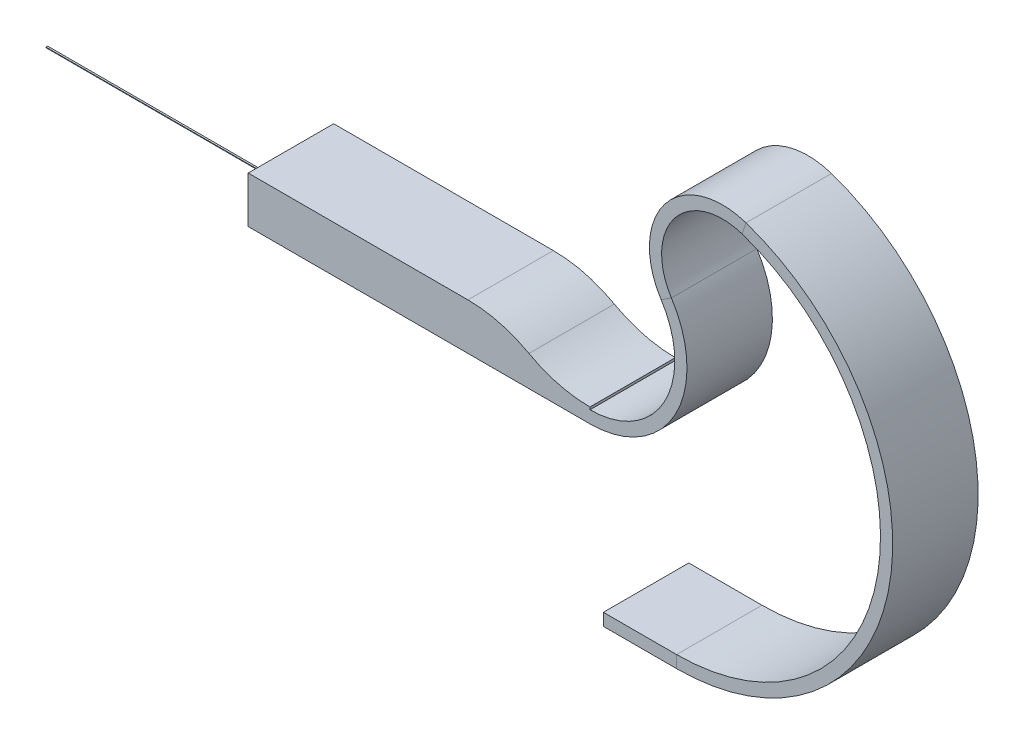
from build123d import *

# Parameters (mm, degrees)
SKETCH1_W               = 14
SKETCH1_H               = 3.5
BOSS_EXTRUDE1_DEPTH     = 1.9
CUT_EXTRUDE1_DEPTH      = 8.461400673
CUT_EXTRUDE1_DEPTH_BACK = 8.461400673
SKETCH4_W               = 0.07
SKETCH4_H               = 0.024
BOSS_EXTRUDE3_DEPTH     = 10
SWEEP1_START            = -1.75
SWEEP1_DEPTH            = 3.5


# Read off the part's stored shape, not the designer's step: Sweep1
with BuildPart() as part:
    # Sketch1 → Boss-Extrude1 (new body)
    with BuildSketch(Plane(origin=(0, 0, 0), x_dir=(1, 0, 0), z_dir=(0, 1, 0))):
        Rectangle(SKETCH1_W, SKETCH1_H)
    extrude(amount=BOSS_EXTRUDE1_DEPTH)

    # Sketch3 → Cut-Extrude1 (cut, two sides: drawn at the far end of the back side and taken through both)
    with BuildSketch(Plane.XY.offset(-CUT_EXTRUDE1_DEPTH_BACK)):
        with BuildLine():
            Line((7, 0.6), (7, 1.9))
            Line((7, 1.9), (2, 1.9))
            ThreePointArc((2, 1.9), (3.291559135, 1.734842828), (4.5, 1.25))
            ThreePointArc((4.5, 1.25), (5.708440865, 0.765157172), (7, 0.6))
        make_face()
    extrude(amount=CUT_EXTRUDE1_DEPTH + CUT_EXTRUDE1_DEPTH_BACK, mode=Mode.SUBTRACT)

    # Sketch4 → Boss-Extrude3 (add)
    with BuildSketch(Plane.ZY.offset(7)):
        with Locations((0, 0.5)):
            Rectangle(SKETCH4_W, SKETCH4_H)
    extrude(amount=BOSS_EXTRUDE3_DEPTH)

    # Sweep1 outline → Sweep1 (add)
    with BuildSketch(Plane.XY.offset(SWEEP1_START)):
        with BuildLine():
            Line((10.549140882, -6.409601789), (7.549140882, -6.409601789))
            Line((7.549140882, -6.409601789), (7.549140882, -6.909601789))
            Line((7.549140882, -6.909601789), (10.549140882, -6.909601789))
            ThreePointArc((10.549140882, -6.909601789), (19.285582655, 0.503552751), (13.39347688, 10.330218748))
            ThreePointArc((13.39347688, 10.330218748), (10.067527148, 9.33364199), (9.916983753, 5.864860714))
            ThreePointArc((9.916983753, 5.864860714), (10.053298409, 2.315301648), (7, 0.5))
            Line((7, 0.5), (7, 0))
            ThreePointArc((7, 0), (10.492566046, 2.076462911), (10.336640265, 6.136684944))
            ThreePointArc((10.336640265, 6.136684944), (10.462056054, 9.026482516), (13.232862483, 9.85671794))
            ThreePointArc((13.232862483, 9.85671794), (18.792251933, 0.584945612), (10.549140882, -6.409601789))
        make_face()
    extrude(amount=SWEEP1_DEPTH)


solid = part.part
